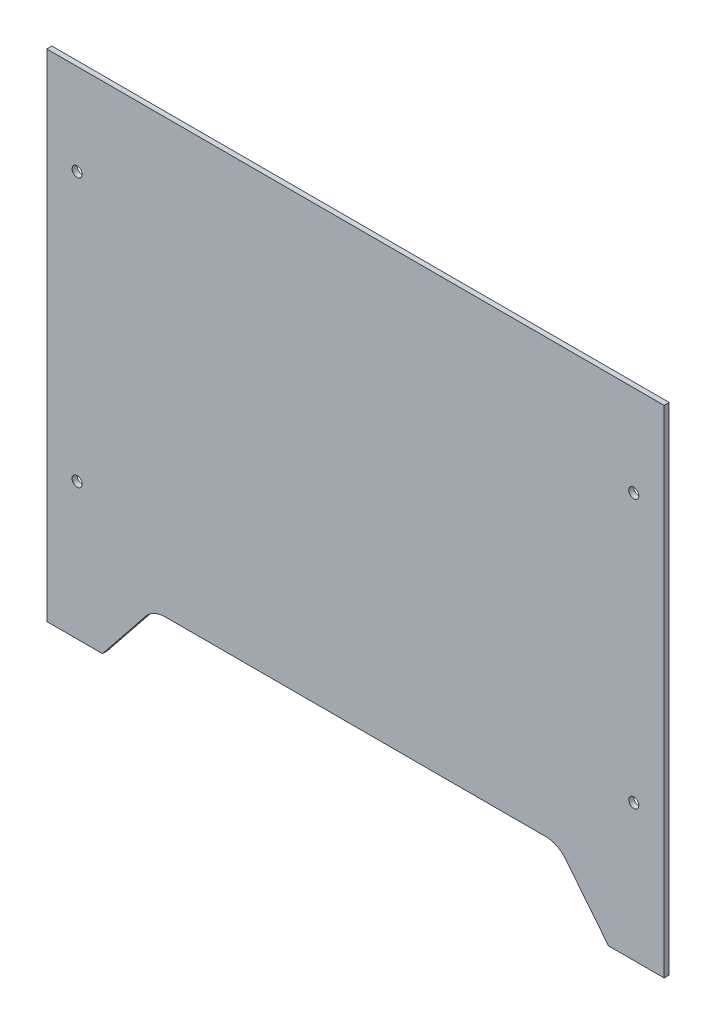
from build123d import *

# Parameters (mm, degrees)
SKETCH1_R           = 2
BOSS_EXTRUDE1_DEPTH = 2


with BuildPart() as part:
    # Sketch1 → Boss-Extrude1 (new body)
    with BuildSketch(Plane.XY):
        with BuildLine():
            Line((-122, -98), (-122, 98))
            Line((-122, 98), (122, 98))
            Line((122, 98), (122, -98))
            Line((122, -98), (100, -98))
            Line((100, -98), (83.00243962, -76.753049524))
            ThreePointArc((83.00243962, -76.753049524), (79.52563883, -73.986967637), (75.193751525, -73))
            Line((75.193751525, -73), (-75.193751525, -73))
            ThreePointArc((-75.193751525, -73), (-79.52563883, -73.986967637), (-83.00243962, -76.753049524))
            Line((-83.00243962, -76.753049524), (-100, -98))
            Line((-100, -98), (-122, -98))
        make_face()
        with Locations((110, 62)):
            Circle(SKETCH1_R, mode=Mode.SUBTRACT)
        with Locations((110, -44)):
            Circle(SKETCH1_R, mode=Mode.SUBTRACT)
        with Locations((-110, -44)):
            Circle(SKETCH1_R, mode=Mode.SUBTRACT)
        with Locations((-110, 62)):
            Circle(SKETCH1_R, mode=Mode.SUBTRACT)
    extrude(amount=BOSS_EXTRUDE1_DEPTH)


solid = part.part
